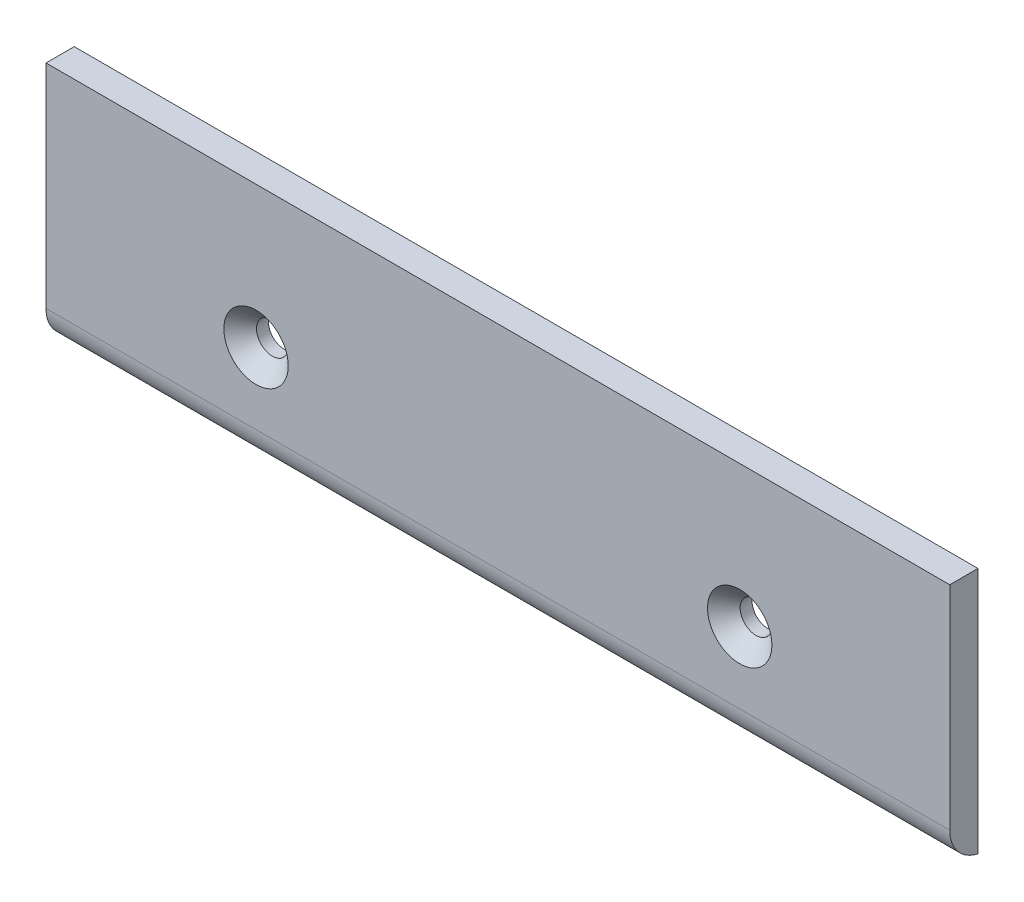
from build123d import *

# Parameters (mm, degrees)
SKETCH_1_W          = 256
SKETCH_1_H          = 70
EXTRUDE_1_DEPTH     = 4
FILLET_1_R          = 10
SHEET_START         = -128
SHEET_METAL_1_DEPTH = 256
FILLET_2_R          = 10


# Read off the part's stored shape, not the designer's step: Преобразовать-Твердое тело1
with BuildPart() as part:
    # Sketch 1 → Бобышка-Вытянуть1 (new, symmetric)
    with BuildSketch(Plane.XY):
        Rectangle(SKETCH_1_W, SKETCH_1_H)
    extrude(amount=EXTRUDE_1_DEPTH, both=True)

    # Скругление1
    # the kernel refuses this fillet: 10 mm, written as the material it takes off along each edge
    with BuildSketch(Plane(origin=(-152.494897428, -35, 4), x_dir=(0, 0, -1), z_dir=(1, 0, 0))) as fillet_1_piece_1:
        with BuildLine():
            CenterArc((10, 9.797958971), FILLET_1_R, 180, 78.463040967)
            Line((0, 9.797958971), (-0.2, 9.797958971))
            Line((-0.2, 9.797958971), (-0.2, 0))
            Line((-0.2, 0), (0, -0.2))
            ThreePointArc((0, -0.2), (4, -0.2), (7.96, -0.195959179))
            Line((7.96, -0.195959179), (8, 0))
        make_face()
    extrude(amount=304.989794856, mode=Mode.SUBTRACT)

    # Sheet Metal 1 outline → Sheet Metal 1 (add)
    with BuildSketch(Plane.YZ.offset(SHEET_START)):
        with BuildLine():
            Line((-35, 4), (-35, -4))
            ThreePointArc((-35, -4), (-31.526596349, 1.745966692), (-25.202041029, 4))
            Line((-25.202041029, 4), (-35, 4))
        make_face()
    extrude(amount=SHEET_METAL_1_DEPTH)

    # Скругление2
    # the kernel refuses this fillet: 10 mm, written as the material it takes off along each edge
    with BuildSketch(Plane(origin=(-152.494897428, -35, 4), x_dir=(0, 1, 0), z_dir=(1, 0, 0))) as fillet_2_piece_1:
        with BuildLine():
            CenterArc((9.797958971, -10), FILLET_2_R, 90, 78.463040967)
            Line((0, -8), (-0.195959179, -7.96))
            ThreePointArc((-0.195959179, -7.96), (-0.2, -4), (-0.2, 0))
            Line((-0.2, 0), (0, 0.2))
            Line((0, 0.2), (9.797958971, 0.2))
            Line((9.797958971, 0.2), (9.797958971, 0))
        make_face()
    extrude(amount=304.989794856, mode=Mode.SUBTRACT)

    # Эскиз8 → Зенковка для винта с потайной головкой M81 (revolve, cut)
    with BuildSketch(Plane(origin=(-68.5, -5, 4), x_dir=(0, -1, 0), z_dir=(1, 0, 0))):
        Polygon((0, 0), (0, 8), (4.5, 8), (4.5, 4.625), (9.125, 0), align=None)
    hole_wizard_m81 = revolve(axis=Axis((-68.5, -5, 10.35), (0, 0, -1)), mode=Mode.SUBTRACT)

    # Зеркальное отражение1: Зенковка для винта с потайной головкой M81 across plane
    add(hole_wizard_m81.mirror(Plane(origin=(0, 0, 0), x_dir=(0, 0, 1), z_dir=(1, 0, 0))), mode=Mode.SUBTRACT)


solid = part.part
